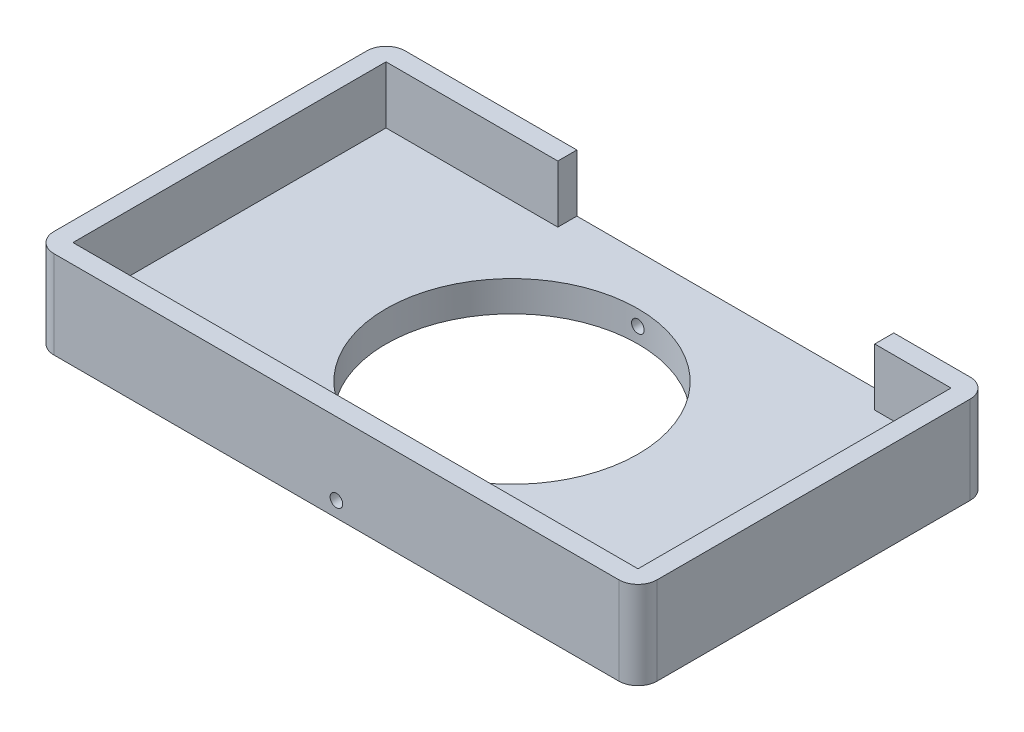
from build123d import *

# Parameters (mm, degrees)
SKETCH1_W             = 158
SKETCH1_H             = 92
BOSS_EXTRUDE1_DEPTH   = 8
SKETCH2_W             = 158
SKETCH2_H             = 92
SKETCH2_W_2           = 148
SKETCH2_H_2           = 82
BOSS_EXTRUDE2_DEPTH   = 15
SKETCH3_R             = 33
CUT_EXTRUDE1_DEPTH    = 95.265582266
FILLET1_R             = 5
FILLET2_R             = 5
SPLIT1_START          = -29
SPLIT1_OUTLINE_W      = 15
SPLIT1_OUTLINE_H      = 5
SPLIT1_DEPTH          = 83
M4X0_7_TAPPED_HOLE1_D = 3.3


# Read off the part's stored shape, not the designer's step: Split1
with BuildPart() as part:
    # Sketch1 → Boss-Extrude1 (new body)
    with BuildSketch(Plane(origin=(0, 0, 0), x_dir=(1, 0, 0), z_dir=(0, 1, 0))):
        Rectangle(SKETCH1_W, SKETCH1_H)
    extrude(amount=BOSS_EXTRUDE1_DEPTH)

    # Sketch2 → Boss-Extrude2 (add)
    with BuildSketch(Plane(origin=(0, 8, 0), x_dir=(1, 0, 0), z_dir=(0, 1, 0))):
        Rectangle(SKETCH2_W, SKETCH2_H)
        Rectangle(SKETCH2_W_2, SKETCH2_H_2, mode=Mode.SUBTRACT)
    extrude(amount=BOSS_EXTRUDE2_DEPTH)

    # Sketch3 → Cut-Extrude1 (cut, through all)
    with BuildSketch(Plane.XZ):
        with Locations(Location((0, 0, 0), (0, 0, 270))):
            Circle(SKETCH3_R)
    extrude(amount=-CUT_EXTRUDE1_DEPTH, mode=Mode.SUBTRACT)

    # Fillet1
    fillet1_edges = [part.edges().sort_by_distance(p)[0] for p in [
        (-79, 11.5, 46),
    ]]
    fillet(fillet1_edges, radius=FILLET1_R)

    # Fillet2
    fillet2_edges = [part.edges().sort_by_distance(p)[0] for p in [
        (79, 11.5, 46),
        (-79, 11.5, -46),
        (79, 11.5, -46),
    ]]
    fillet(fillet2_edges, radius=FILLET2_R)

    # Split1 outline → Split1 (cut)
    with BuildSketch(Plane.YZ.offset(SPLIT1_START)):
        with Locations((15.5, -43.5)):
            Rectangle(SPLIT1_OUTLINE_W, SPLIT1_OUTLINE_H)
    extrude(amount=SPLIT1_DEPTH, mode=Mode.SUBTRACT)

    # M4x0.7 Tapped Hole1 (through all)
    with Locations(Plane.XY.offset(46)):
        with Locations((0, 4)):
            Hole(M4X0_7_TAPPED_HOLE1_D / 2)


solid = part.part
